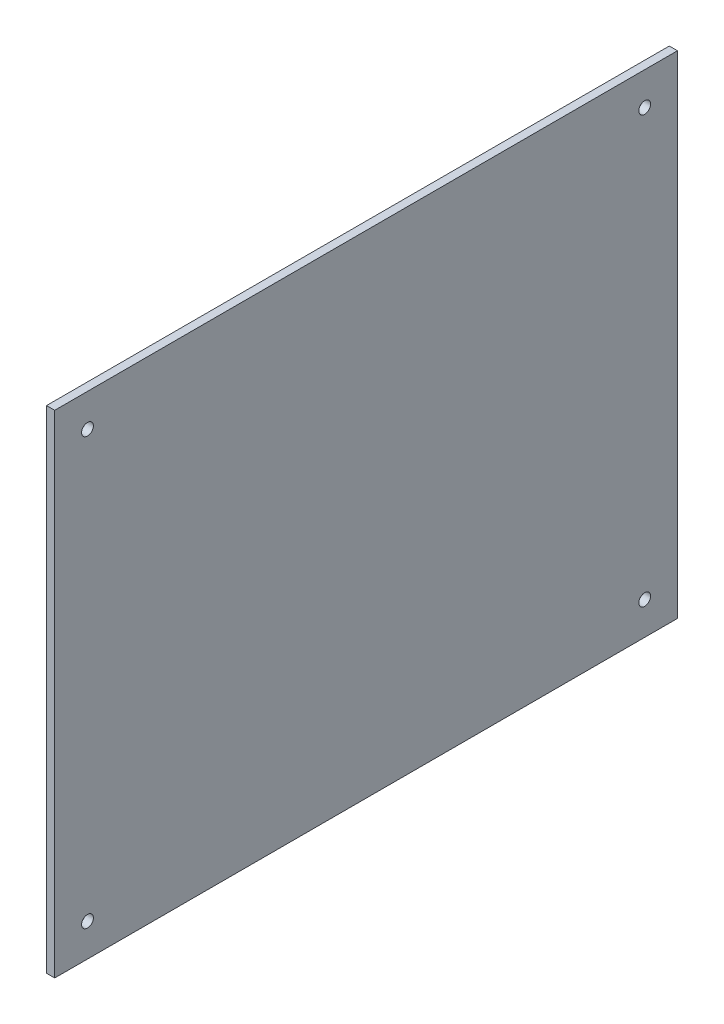
from build123d import *

# Parameters (mm, degrees)
SKETCH1_W           = 241.3
SKETCH1_H           = 190.5
BOSS_EXTRUDE1_DEPTH = 3.175
SKETCH2_R           = 2.286
CUT_EXTRUDE1_DEPTH  = 308.450842616


with BuildPart() as part:
    # Sketch1 → Boss-Extrude1 (new body)
    with BuildSketch(Plane(origin=(0, 0, 0), x_dir=(0, 0, -1), z_dir=(1, 0, 0))):
        with Locations((120.65, 95.25)):
            Rectangle(SKETCH1_W, SKETCH1_H)
    extrude(amount=BOSS_EXTRUDE1_DEPTH)

    # Sketch2 → Cut-Extrude1 (cut, through all)
    with BuildSketch(Plane(origin=(3.175, 0, 0), x_dir=(0, 0, -1), z_dir=(1, 0, 0))):
        with Locations((228.6, 12.7)):
            Circle(SKETCH2_R)
        with Locations((228.6, 177.8)):
            Circle(SKETCH2_R)
        with Locations((12.7, 12.7)):
            Circle(SKETCH2_R)
        with Locations((12.7, 177.8)):
            Circle(SKETCH2_R)
    extrude(amount=-CUT_EXTRUDE1_DEPTH, mode=Mode.SUBTRACT)


solid = part.part
